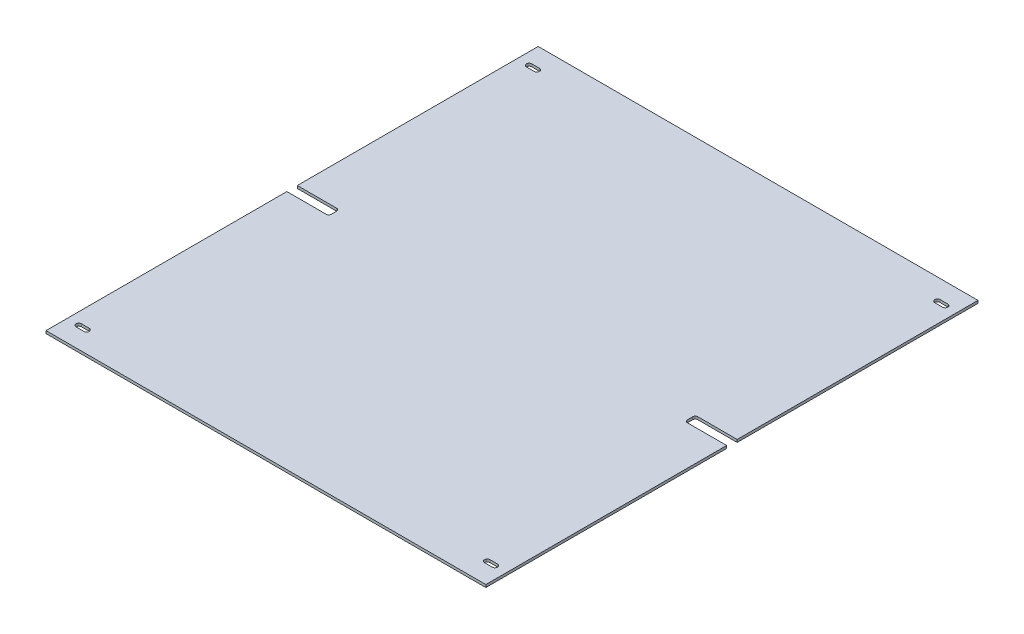
from build123d import *

# Parameters (mm, degrees)
SKETCH1_W                    = 533.4
SKETCH1_H                    = 596.9
BOSS_EXTRUDE1_DEPTH          = 3.175
F_0_257_DIAMETER_SLOT1_DEPTH = 3.175
CUT_EXTRUDE1_DEPTH           = 401.264129201


# Read off the part's stored shape, not the designer's step: F (0.257) Diameter Slot1
with BuildPart() as part:
    # Sketch1 → Boss-Extrude1 (new body)
    with BuildSketch(Plane(origin=(0, 0, 0), x_dir=(1, 0, 0), z_dir=(0, 1, 0))):
        Rectangle(SKETCH1_W, SKETCH1_H)
    extrude(amount=BOSS_EXTRUDE1_DEPTH)

    # F (0.257) Diameter Slot1 outline → F (0.257) Diameter Slot1 (cut)
    with BuildSketch(Plane(origin=(0, 0, 0), x_dir=(1, 0, 0), z_dir=(0, 1, 0))):
        with BuildLine():
            Line((242.9764, -276.3139), (252.3236, -276.3139))
            ThreePointArc((252.3236, -276.3139), (255.5875, -273.05), (252.3236, -269.7861))
            Line((252.3236, -269.7861), (242.9764, -269.7861))
            ThreePointArc((242.9764, -269.7861), (239.7125, -273.05), (242.9764, -276.3139))
        make_face()
        with BuildLine():
            ThreePointArc((-242.9764, -276.3139), (-239.7125, -273.05), (-242.9764, -269.7861))
            Line((-242.9764, -269.7861), (-252.3236, -269.7861))
            ThreePointArc((-252.3236, -269.7861), (-255.5875, -273.05), (-252.3236, -276.3139))
            Line((-252.3236, -276.3139), (-242.9764, -276.3139))
        make_face()
        with BuildLine():
            Line((242.9764, 269.7861), (252.3236, 269.7861))
            ThreePointArc((252.3236, 269.7861), (255.5875, 273.05), (252.3236, 276.3139))
            Line((252.3236, 276.3139), (242.9764, 276.3139))
            ThreePointArc((242.9764, 276.3139), (239.7125, 273.05), (242.9764, 269.7861))
        make_face()
        with BuildLine():
            ThreePointArc((-242.9764, 269.7861), (-239.7125, 273.05), (-242.9764, 276.3139))
            Line((-242.9764, 276.3139), (-252.3236, 276.3139))
            ThreePointArc((-252.3236, 276.3139), (-255.5875, 273.05), (-252.3236, 269.7861))
            Line((-252.3236, 269.7861), (-242.9764, 269.7861))
        make_face()
    extrude(amount=F_0_257_DIAMETER_SLOT1_DEPTH, mode=Mode.SUBTRACT)

    # Sketch5 → Cut-Extrude1 (cut, through all)
    with BuildSketch(Plane(origin=(0, 3.175, 0), x_dir=(1, 0, 0), z_dir=(0, 1, 0))):
        with BuildLine():
            Line((219.075, 6.35), (266.7, 6.35))
            Line((266.7, 6.35), (266.7, -6.35))
            Line((266.7, -6.35), (219.075, -6.35))
            ThreePointArc((219.075, -6.35), (216.82993597, -5.42006403), (215.9, -3.175))
            Line((215.9, -3.175), (215.9, 3.175))
            ThreePointArc((215.9, 3.175), (216.82993597, 5.42006403), (219.075, 6.35))
        make_face()
        with BuildLine():
            Line((-266.7, 6.35), (-266.7, -6.35))
            Line((-266.7, -6.35), (-219.075, -6.35))
            ThreePointArc((-219.075, -6.35), (-216.82993597, -5.42006403), (-215.9, -3.175))
            Line((-215.9, -3.175), (-215.9, 3.175))
            ThreePointArc((-215.9, 3.175), (-216.82993597, 5.42006403), (-219.075, 6.35))
            Line((-219.075, 6.35), (-266.7, 6.35))
        make_face()
    extrude(amount=-CUT_EXTRUDE1_DEPTH, mode=Mode.SUBTRACT)


solid = part.part
